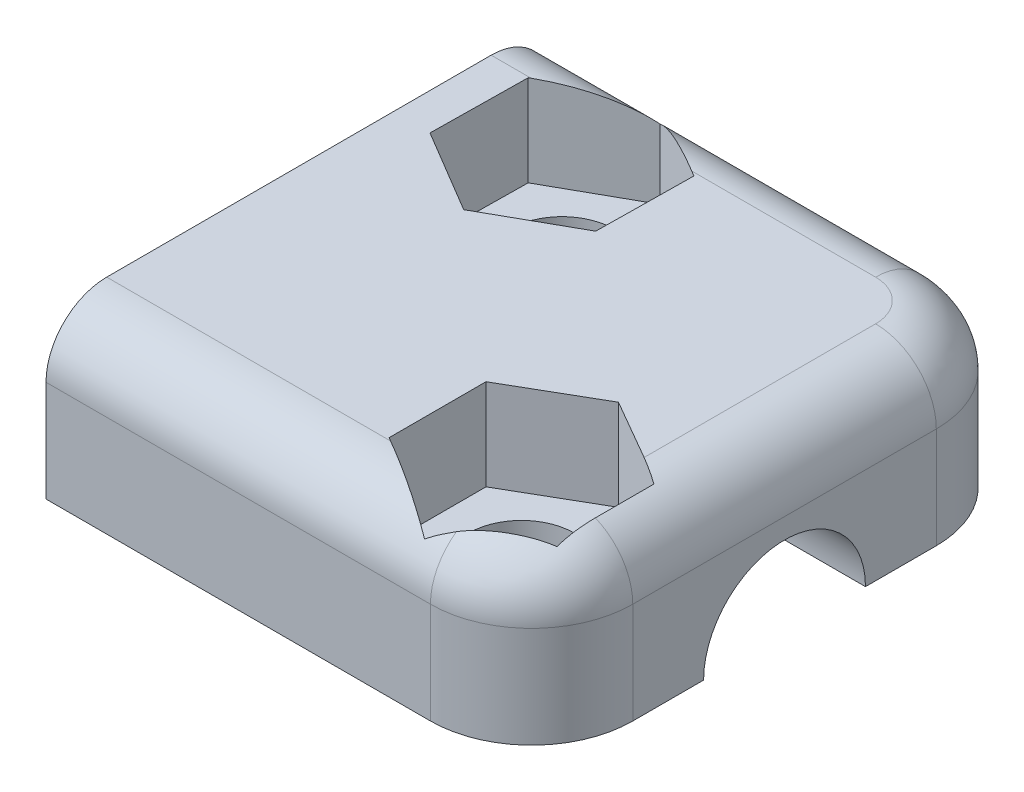
from build123d import *

# Parameters (mm, degrees)
SKETCH1_W           = 24
SKETCH1_H           = 25
BOSS_EXTRUDE1_DEPTH = 8
SKETCH2_R           = 4
CUT_EXTRUDE1_DEPTH  = 29.217902119
SKETCH3_R           = 2.6
CUT_EXTRUDE2_DEPTH  = 20.085334684
FILLET1_R           = 3
FILLET2_R           = 5
CUT_EXTRUDE3_DEPTH  = 4.5


with BuildPart() as part:
    # Sketch1 → Boss-Extrude1 (new body)
    with BuildSketch(Plane(origin=(0, 0, 0), x_dir=(1, 0, 0), z_dir=(0, 1, 0))):
        Rectangle(SKETCH1_W, SKETCH1_H)
    extrude(amount=BOSS_EXTRUDE1_DEPTH)

    # Sketch2 → Cut-Extrude1 (cut, through all)
    with BuildSketch(Plane.ZY.offset(12)):
        Circle(SKETCH2_R)
    extrude(amount=-CUT_EXTRUDE1_DEPTH, mode=Mode.SUBTRACT)

    # Sketch3 → Cut-Extrude2 (cut, through all)
    with BuildSketch(Plane.XZ):
        with Locations(Location((-6, -7, 0), (0, 0, 270))):
            Circle(SKETCH3_R)
        with Locations(Location((6, 7, 0), (0, 0, 270))):
            Circle(SKETCH3_R)
    extrude(amount=-CUT_EXTRUDE2_DEPTH, mode=Mode.SUBTRACT)

    # Fillet1
    # the kernel refuses this fillet: 3 mm, written as the material it takes off along each edge
    with BuildSketch(Plane(origin=(19.5, 8, 12.5), x_dir=(0, 0, -1), z_dir=(-1, 0, 0))) as fillet1_piece_1:
        with BuildLine():
            CenterArc((FILLET1_R, FILLET1_R), FILLET1_R, 180, 90)
            Line((0, FILLET1_R), (0, 0))
            Line((0, 0), (FILLET1_R, 0))
        make_face()
    extrude(amount=39, mode=Mode.SUBTRACT)
    with BuildSketch(Plane(origin=(12, 8, -20), x_dir=(0, -1, 0), z_dir=(0, 0, 1))) as fillet1_piece_2:
        with BuildLine():
            CenterArc((FILLET1_R, -FILLET1_R), FILLET1_R, 90, 90)
            Line((0, -FILLET1_R), (0, 0))
            Line((0, 0), (FILLET1_R, 0))
        make_face()
    extrude(amount=40, mode=Mode.SUBTRACT)
    with BuildSketch(Plane(origin=(-19.5, 8, -12.5), x_dir=(0, -1, 0), z_dir=(1, 0, 0))) as fillet1_piece_3:
        with BuildLine():
            CenterArc((FILLET1_R, -FILLET1_R), FILLET1_R, 90, 90)
            Line((0, -FILLET1_R), (0, 0))
            Line((0, 0), (FILLET1_R, 0))
        make_face()
    extrude(amount=39, mode=Mode.SUBTRACT)

    # Fillet2
    # the kernel refuses this fillet: 5 mm, written as the material it takes off along each edge
    with BuildSketch(Plane(origin=(7, 8, 7.5), x_dir=(0, 0, 1), z_dir=(-1, 0, 0))) as fillet2_piece_1:
        with BuildLine():
            CenterArc((2, -3), 3, 0, 90)
            Line((5, -3), (5, 0))
            Line((5, 0), (2, 0))
        make_face()
    revolve(axis=Axis((7, 8, 7.5), (0, 1, 0)), revolution_arc=90, mode=Mode.SUBTRACT)
    with BuildSketch(Plane(origin=(7, 8, -7.5), x_dir=(1, 0, 0), z_dir=(0, 0, 1))) as fillet2_piece_2:
        with BuildLine():
            CenterArc((2, -3), 3, 0, 90)
            Line((5, -3), (5, 0))
            Line((5, 0), (2, 0))
        make_face()
    revolve(axis=Axis((7, 8, -7.5), (0, 1, 0)), revolution_arc=90, mode=Mode.SUBTRACT)
    with BuildSketch(Plane(origin=(12, -12.5, -12.5), x_dir=(-1, 0, 0), z_dir=(0, 1, 0)), Plane(origin=(12, -12.5, 12.5), x_dir=(0, 0, -1), z_dir=(0, 1, 0))) as fillet2_piece_3:
        with BuildLine():
            CenterArc((FILLET2_R, FILLET2_R), FILLET2_R, 180, 90)
            Line((0, FILLET2_R), (0, 0))
            Line((0, 0), (FILLET2_R, 0))
        make_face()
    extrude(amount=20.5, mode=Mode.SUBTRACT)

    # Sketch4 → Cut-Extrude3 (cut)
    with BuildSketch(Plane(origin=(0, 8, 0), x_dir=(1, 0, 0), z_dir=(0, 1, 0))):
        Polygon((6, -11.792007234), (10.15, -9.396003617), (10.15, -4.603996383), (6, -2.207992766), (1.85, -4.603996383), (1.85, -9.396003617), align=None)
        Polygon((-6.063761716, 2.208416986), (-1.882248244, 4.548989227), (-1.818486528, 9.340572241), (-5.936238284, 11.791583014), (-10.117751756, 9.451010773), (-10.181513472, 4.659427759), align=None)
    extrude(amount=-CUT_EXTRUDE3_DEPTH, mode=Mode.SUBTRACT)


solid = part.part
